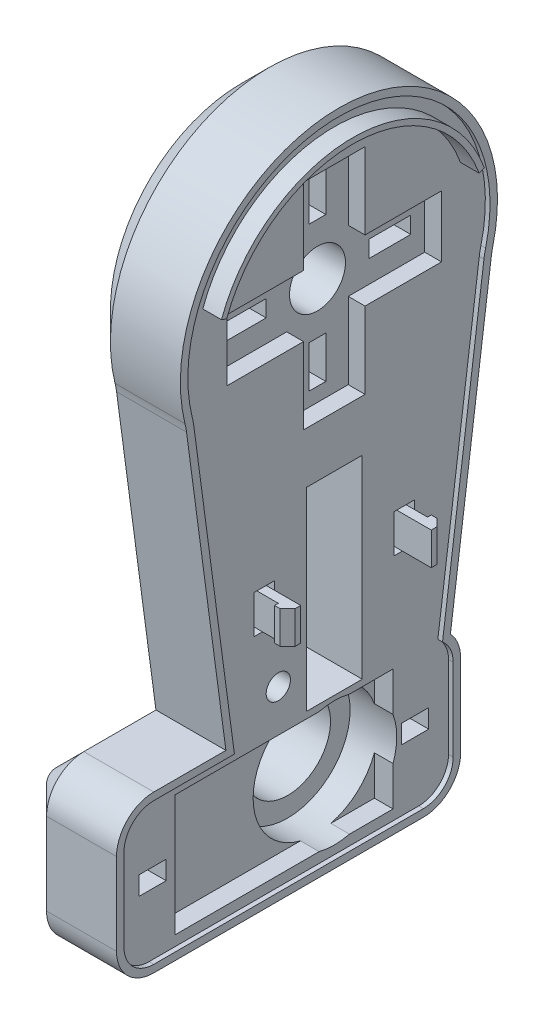
from build123d import *

# Parameters (mm, degrees)
BOSS_EXTRUDE1_START  = -76.4
BOSS_EXTRUDE1_DEPTH  = 10.5
BOSS_EXTRUDE2_START  = -66.4
BOSS_EXTRUDE2_DEPTH  = 0.6
CHAMFER1_SIZE        = 3
CHAMFER2_SIZE        = 3
BOSS_EXTRUDE3_START  = 62.7
SKETCH3_W            = 2.3
SKETCH3_H            = 23
BOSS_EXTRUDE3_DEPTH  = 6.6
BOSS_EXTRUDE4_START  = 54.5
SKETCH4_W            = 2.3
SKETCH4_H            = 6.6
BOSS_EXTRUDE4_DEPTH  = 23
BOSS_EXTRUDE5_START  = -68.2
SKETCH5_R            = 4.6
BOSS_EXTRUDE5_DEPTH  = 2.3
BOSS_EXTRUDE6_START  = -76.9
SKETCH6_R            = 6.1
BOSS_EXTRUDE6_DEPTH  = 1.7
BOSS_EXTRUDE7_START  = -75.3
SKETCH7_R            = 3
BOSS_EXTRUDE7_DEPTH  = 7.2
BOSS_EXTRUDE8_START  = 65.1
SKETCH8_W            = 6.1
SKETCH8_H            = 1.1
BOSS_EXTRUDE8_DEPTH  = 1.8
BOSS_EXTRUDE9_START  = 71.5
SKETCH9_W            = 6.1
SKETCH9_H            = 1.8
BOSS_EXTRUDE9_DEPTH  = 1.1
BOSS_EXTRUDE10_START = 65.1
SKETCH10_W           = 6.1
SKETCH10_H           = 1.1
BOSS_EXTRUDE10_DEPTH = 1.8
BOSS_EXTRUDE11_START = 59.4
SKETCH11_W           = 6.1
SKETCH11_H           = 1.8
BOSS_EXTRUDE11_DEPTH = 1.1
BOSS_EXTRUDE12_START = 65.1
SKETCH12_W           = 7.3
SKETCH12_H           = 3.4
BOSS_EXTRUDE12_DEPTH = 1.8
BOSS_EXTRUDE13_START = 72.6
SKETCH13_W           = 7.3
SKETCH13_H           = 1.8
BOSS_EXTRUDE13_DEPTH = 3.4
BOSS_EXTRUDE14_START = 65.1
SKETCH14_W           = 7.3
SKETCH14_H           = 3.4
BOSS_EXTRUDE14_DEPTH = 1.8
BOSS_EXTRUDE15_START = 56
SKETCH15_W           = 7.3
SKETCH15_H           = 1.8
BOSS_EXTRUDE15_DEPTH = 3.4
BOSS_EXTRUDE16_START = -66.45
BOSS_EXTRUDE16_DEPTH = 2.05
BOSS_EXTRUDE17_START = 55.875
SKETCH17_W           = 4.1
SKETCH17_H           = 2
BOSS_EXTRUDE17_DEPTH = 2.9
BOSS_EXTRUDE18_START = 84.025
SKETCH18_W           = 4.1
SKETCH18_H           = 2
BOSS_EXTRUDE18_DEPTH = 2.9
BOSS_EXTRUDE19_START = 59.7
SKETCH19_W           = 2.1
SKETCH19_H           = 13
BOSS_EXTRUDE19_DEPTH = 23.4
BOSS_EXTRUDE20_START = -71.4
SKETCH20_R           = 6.7
BOSS_EXTRUDE20_DEPTH = 5.1
BOSS_EXTRUDE21_START = -76.9
SKETCH21_R           = 4.6
BOSS_EXTRUDE21_DEPTH = 5.8
BOSS_EXTRUDE22_START = 63
SKETCH22_W           = 8.3
SKETCH22_H           = 20.8
BOSS_EXTRUDE22_DEPTH = 6
BOSS_EXTRUDE23_START = -76.9
SKETCH23_R           = 2.3
BOSS_EXTRUDE23_DEPTH = 6
BOSS_EXTRUDE24_START = -70.95
SKETCH24_R           = 1.3
BOSS_EXTRUDE24_DEPTH = 4.65
BOSS_EXTRUDE25_START = 57.4
SKETCH25_W           = 4.1
SKETCH25_H           = 4.1
BOSS_EXTRUDE25_DEPTH = 2.2
BOSS_EXTRUDE26_START = -47.75
BOSS_EXTRUDE26_DEPTH = 3.5
BOSS_EXTRUDE27_START = 72.4
SKETCH27_W           = 4.1
SKETCH27_H           = 4.1
BOSS_EXTRUDE27_DEPTH = 2.2
BOSS_EXTRUDE28_START = -47.75
BOSS_EXTRUDE28_DEPTH = 3.5


with BuildPart() as part:
    # Sketch1 → Boss-Extrude1 (new body)
    with BuildSketch(Plane(origin=(0, 0, 0), x_dir=(0, 0, -1), z_dir=(1, 0, 0)).offset(BOSS_EXTRUDE1_START)):
        with BuildLine():
            Line((-49.657293521, -24.929701405), (-54.04649339, -57.848700423))
            ThreePointArc((-54.04649339, -57.848700423), (-53.234221048, -59.119126346), (-52.95, -60.6))
            Line((-52.95, -60.6), (-52.95, -69.4))
            ThreePointArc((-52.95, -69.4), (-54.121572875, -72.228427125), (-56.95, -73.4))
            Line((-56.95, -73.4), (-85.85, -73.4))
            ThreePointArc((-85.85, -73.4), (-88.678427125, -72.228427125), (-89.85, -69.4))
            Line((-89.85, -69.4), (-89.85, -60.6))
            ThreePointArc((-89.85, -60.6), (-88.678427125, -57.771572875), (-85.85, -56.6))
            Line((-85.85, -56.6), (-78.12, -56.6))
            Line((-78.12, -56.6), (-82.342706479, -24.929701405))
            ThreePointArc((-82.342706479, -24.929701405), (-82.412282932, -24.49821266), (-82.505320186, -24.071167593))
            ThreePointArc((-82.505320186, -24.071167593), (-66, -3), (-49.494679814, -24.071167593))
            ThreePointArc((-49.494679814, -24.071167593), (-49.587717068, -24.49821266), (-49.657293521, -24.929701405))
        make_face()
    extrude(amount=BOSS_EXTRUDE1_DEPTH)


with BuildPart() as body_2:
    # Sketch2 → Boss-Extrude2 (new body)
    with BuildSketch(Plane(origin=(0, 0, 0), x_dir=(0, 0, -1), z_dir=(1, 0, 0)).offset(BOSS_EXTRUDE2_START)):
        with BuildLine():
            Line((-50.450275841, -24.823970429), (-54.893518409, -58.148289686))
            ThreePointArc((-54.893518409, -58.148289686), (-54.049936113, -59.247362039), (-53.75, -60.6))
            Line((-53.75, -60.6), (-53.75, -69.4))
            ThreePointArc((-53.75, -69.4), (-54.6872583, -71.6627417), (-56.95, -72.6))
            Line((-56.95, -72.6), (-85.85, -72.6))
            ThreePointArc((-85.85, -72.6), (-88.1127417, -71.6627417), (-89.05, -69.4))
            Line((-89.05, -69.4), (-89.05, -60.6))
            ThreePointArc((-89.05, -60.6), (-88.1127417, -58.3372583), (-85.85, -57.4))
            Line((-85.85, -57.4), (-77.206253549, -57.4))
            Line((-77.206253549, -57.4), (-81.549724159, -24.823970429))
            ThreePointArc((-81.549724159, -24.823970429), (-81.626258257, -24.34933281), (-81.728599236, -23.879583236))
            ThreePointArc((-81.728599236, -23.879583236), (-66, -3.8), (-50.271400764, -23.879583236))
            ThreePointArc((-50.271400764, -23.879583236), (-50.373741743, -24.34933281), (-50.450275841, -24.823970429))
        make_face()
    extrude(amount=BOSS_EXTRUDE2_DEPTH)


with BuildPart() as part_1:
    add(part.part)

    # Combine1: cut body 2
    add(body_2.part, mode=Mode.SUBTRACT)

    # Chamfer1
    chamfer1_edges = [part_1.edges().sort_by_distance(p)[0] for p in [
        (-76.4, -3, 66),
        (-76.4, -24.49821266, 49.587717068),
        (-76.4, -41.389200914, 51.851893455),
        (-76.4, -40.764850703, 80.23135324),
        (-76.4, -24.49821266, 82.412282932),
    ]]
    chamfer(chamfer1_edges, length=CHAMFER1_SIZE)

    # Chamfer2
    chamfer2_edges = [part_1.edges().sort_by_distance(p)[0] for p in [
        (-76.4, -57.786965833, 54.106263237),
        (-76.4, -65, 52.95),
        (-76.4, -72.228427125, 54.121572875),
        (-76.4, -73.4, 71.4),
        (-76.4, -72.228427125, 88.678427125),
        (-76.4, -65, 89.85),
        (-76.4, -57.771572875, 88.678427125),
        (-76.4, -56.6, 80.471725405),
    ]]
    chamfer(chamfer2_edges, length=CHAMFER2_SIZE)


with BuildPart() as body_2_2:
    # Sketch3 → Boss-Extrude3 (new body)
    with BuildSketch(Plane.XY.offset(BOSS_EXTRUDE3_START)):
        with Locations((-67.05, -20)):
            Rectangle(SKETCH3_W, SKETCH3_H)
    extrude(amount=BOSS_EXTRUDE3_DEPTH)


with BuildPart() as part_2:
    add(part_1.part)

    # Combine2: cut body 2 2
    add(body_2_2.part, mode=Mode.SUBTRACT)


with BuildPart() as body_2_3:
    # Sketch4 → Boss-Extrude4 (new body)
    with BuildSketch(Plane.XY.offset(BOSS_EXTRUDE4_START)):
        with Locations((-67.05, -20)):
            Rectangle(SKETCH4_W, SKETCH4_H)
    extrude(amount=BOSS_EXTRUDE4_DEPTH)


with BuildPart() as part_3:
    add(part_2.part)

    # Combine3: cut body 2 3
    add(body_2_3.part, mode=Mode.SUBTRACT)


with BuildPart() as body_2_4:
    # Sketch5 → Boss-Extrude5 (new body)
    with BuildSketch(Plane(origin=(0, 0, 0), x_dir=(0, 0, -1), z_dir=(1, 0, 0)).offset(BOSS_EXTRUDE5_START)):
        with Locations((-66, -20)):
            Circle(SKETCH5_R)
    extrude(amount=BOSS_EXTRUDE5_DEPTH)


with BuildPart() as part_4:
    add(part_3.part)

    # Combine4: cut body 2 4
    add(body_2_4.part, mode=Mode.SUBTRACT)


with BuildPart() as body_2_5:
    # Sketch6 → Boss-Extrude6 (new body)
    with BuildSketch(Plane(origin=(0, 0, 0), x_dir=(0, 0, -1), z_dir=(1, 0, 0)).offset(BOSS_EXTRUDE6_START)):
        with Locations((-66, -20)):
            Circle(SKETCH6_R)
    extrude(amount=BOSS_EXTRUDE6_DEPTH)


with BuildPart() as part_5:
    add(part_4.part)

    # Combine5: cut body 2 5
    add(body_2_5.part, mode=Mode.SUBTRACT)


with BuildPart() as body_2_6:
    # Sketch7 → Boss-Extrude7 (new body)
    with BuildSketch(Plane(origin=(0, 0, 0), x_dir=(0, 0, -1), z_dir=(1, 0, 0)).offset(BOSS_EXTRUDE7_START)):
        with Locations((-66, -20)):
            Circle(SKETCH7_R)
    extrude(amount=BOSS_EXTRUDE7_DEPTH)


with BuildPart() as part_6:
    add(part_5.part)

    # Combine6: cut body 2 6
    add(body_2_6.part, mode=Mode.SUBTRACT)


with BuildPart() as body_2_7:
    # Sketch8 → Boss-Extrude8 (new body)
    with BuildSketch(Plane.XY.offset(BOSS_EXTRUDE8_START)):
        with Locations((-71.15, -13.95)):
            Rectangle(SKETCH8_W, SKETCH8_H)
    extrude(amount=BOSS_EXTRUDE8_DEPTH)


with BuildPart() as part_7:
    add(part_6.part)

    # Combine7: cut body 2 7
    add(body_2_7.part, mode=Mode.SUBTRACT)


with BuildPart() as body_2_8:
    # Sketch9 → Boss-Extrude9 (new body)
    with BuildSketch(Plane.XY.offset(BOSS_EXTRUDE9_START)):
        with Locations((-71.15, -20)):
            Rectangle(SKETCH9_W, SKETCH9_H)
    extrude(amount=BOSS_EXTRUDE9_DEPTH)


with BuildPart() as part_8:
    add(part_7.part)

    # Combine8: cut body 2 8
    add(body_2_8.part, mode=Mode.SUBTRACT)


with BuildPart() as body_2_9:
    # Sketch10 → Boss-Extrude10 (new body)
    with BuildSketch(Plane.XY.offset(BOSS_EXTRUDE10_START)):
        with Locations((-71.15, -26.05)):
            Rectangle(SKETCH10_W, SKETCH10_H)
    extrude(amount=BOSS_EXTRUDE10_DEPTH)


with BuildPart() as part_9:
    add(part_8.part)

    # Combine9: cut body 2 9
    add(body_2_9.part, mode=Mode.SUBTRACT)


with BuildPart() as body_2_10:
    # Sketch11 → Boss-Extrude11 (new body)
    with BuildSketch(Plane.XY.offset(BOSS_EXTRUDE11_START)):
        with Locations((-71.15, -20)):
            Rectangle(SKETCH11_W, SKETCH11_H)
    extrude(amount=BOSS_EXTRUDE11_DEPTH)


with BuildPart() as part_10:
    add(part_9.part)

    # Combine10: cut body 2 10
    add(body_2_10.part, mode=Mode.SUBTRACT)


with BuildPart() as body_2_11:
    # Sketch12 → Boss-Extrude12 (new body)
    with BuildSketch(Plane.XY.offset(BOSS_EXTRUDE12_START)):
        with Locations((-71.75, -11.7)):
            Rectangle(SKETCH12_W, SKETCH12_H)
    extrude(amount=BOSS_EXTRUDE12_DEPTH)


with BuildPart() as part_11:
    add(part_10.part)

    # Combine11: cut body 2 11
    add(body_2_11.part, mode=Mode.SUBTRACT)


with BuildPart() as body_2_12:
    # Sketch13 → Boss-Extrude13 (new body)
    with BuildSketch(Plane.XY.offset(BOSS_EXTRUDE13_START)):
        with Locations((-71.75, -20)):
            Rectangle(SKETCH13_W, SKETCH13_H)
    extrude(amount=BOSS_EXTRUDE13_DEPTH)


with BuildPart() as part_12:
    add(part_11.part)

    # Combine12: cut body 2 12
    add(body_2_12.part, mode=Mode.SUBTRACT)


with BuildPart() as body_2_13:
    # Sketch14 → Boss-Extrude14 (new body)
    with BuildSketch(Plane.XY.offset(BOSS_EXTRUDE14_START)):
        with Locations((-71.75, -28.3)):
            Rectangle(SKETCH14_W, SKETCH14_H)
    extrude(amount=BOSS_EXTRUDE14_DEPTH)


with BuildPart() as part_13:
    add(part_12.part)

    # Combine13: cut body 2 13
    add(body_2_13.part, mode=Mode.SUBTRACT)


with BuildPart() as body_2_14:
    # Sketch15 → Boss-Extrude15 (new body)
    with BuildSketch(Plane.XY.offset(BOSS_EXTRUDE15_START)):
        with Locations((-71.75, -20)):
            Rectangle(SKETCH15_W, SKETCH15_H)
    extrude(amount=BOSS_EXTRUDE15_DEPTH)


with BuildPart() as part_14:
    add(part_13.part)

    # Combine14: cut body 2 14
    add(body_2_14.part, mode=Mode.SUBTRACT)

    # Sketch16 → Boss-Extrude16 (add)
    with BuildSketch(Plane(origin=(0, 0, 0), x_dir=(0, 0, -1), z_dir=(1, 0, 0)).offset(BOSS_EXTRUDE16_START)):
        with BuildLine():
            Line((-51.904610688, -14.86969785), (-52.468426261, -15.074909936))
            ThreePointArc((-52.468426261, -15.074909936), (-66, -5.6), (-79.531573739, -15.074909936))
            Line((-79.531573739, -15.074909936), (-80.095389312, -14.86969785))
            ThreePointArc((-80.095389312, -14.86969785), (-66, -5), (-51.904610688, -14.86969785))
        make_face()
    extrude(amount=BOSS_EXTRUDE16_DEPTH)


with BuildPart() as body_2_15:
    # Sketch17 → Boss-Extrude17 (new body)
    with BuildSketch(Plane.XY.offset(BOSS_EXTRUDE17_START)):
        with Locations((-68.35, -65)):
            Rectangle(SKETCH17_W, SKETCH17_H)
    extrude(amount=BOSS_EXTRUDE17_DEPTH)


with BuildPart() as part_15:
    add(part_14.part)

    # Combine15: cut body 2 15
    add(body_2_15.part, mode=Mode.SUBTRACT)


with BuildPart() as body_2_16:
    # Sketch18 → Boss-Extrude18 (new body)
    with BuildSketch(Plane.XY.offset(BOSS_EXTRUDE18_START)):
        with Locations((-68.35, -65)):
            Rectangle(SKETCH18_W, SKETCH18_H)
    extrude(amount=BOSS_EXTRUDE18_DEPTH)


with BuildPart() as part_16:
    add(part_15.part)

    # Combine16: cut body 2 16
    add(body_2_16.part, mode=Mode.SUBTRACT)


with BuildPart() as body_2_17:
    # Sketch19 → Boss-Extrude19 (new body)
    with BuildSketch(Plane.XY.offset(BOSS_EXTRUDE19_START)):
        with Locations((-67.35, -65)):
            Rectangle(SKETCH19_W, SKETCH19_H)
    extrude(amount=BOSS_EXTRUDE19_DEPTH)


with BuildPart() as part_17:
    add(part_16.part)

    # Combine17: cut body 2 17
    add(body_2_17.part, mode=Mode.SUBTRACT)


with BuildPart() as body_2_18:
    # Sketch20 → Boss-Extrude20 (new body)
    with BuildSketch(Plane(origin=(0, 0, 0), x_dir=(0, 0, -1), z_dir=(1, 0, 0)).offset(BOSS_EXTRUDE20_START)):
        with Locations((-66, -65)):
            Circle(SKETCH20_R)
    extrude(amount=BOSS_EXTRUDE20_DEPTH)


with BuildPart() as part_18:
    add(part_17.part)

    # Combine18: cut body 2 18
    add(body_2_18.part, mode=Mode.SUBTRACT)


with BuildPart() as body_2_19:
    # Sketch21 → Boss-Extrude21 (new body)
    with BuildSketch(Plane(origin=(0, 0, 0), x_dir=(0, 0, -1), z_dir=(1, 0, 0)).offset(BOSS_EXTRUDE21_START)):
        with Locations(Location((-66, -65, 0), (0, 0, 180))):
            Circle(SKETCH21_R)
    extrude(amount=BOSS_EXTRUDE21_DEPTH)


with BuildPart() as part_19:
    add(part_18.part)

    # Combine19: cut body 2 19
    add(body_2_19.part, mode=Mode.SUBTRACT)


with BuildPart() as body_2_20:
    # Sketch22 → Boss-Extrude22 (new body)
    with BuildSketch(Plane.XY.offset(BOSS_EXTRUDE22_START)):
        with Locations((-70.45, -47.4)):
            Rectangle(SKETCH22_W, SKETCH22_H)
    extrude(amount=BOSS_EXTRUDE22_DEPTH)


with BuildPart() as part_20:
    add(part_19.part)

    # Combine20: cut body 2 20
    add(body_2_20.part, mode=Mode.SUBTRACT)


with BuildPart() as body_2_21:
    # Sketch23 → Boss-Extrude23 (new body)
    with BuildSketch(Plane(origin=(0, 0, 0), x_dir=(0, 0, -1), z_dir=(1, 0, 0)).offset(BOSS_EXTRUDE23_START)):
        with Locations((-72, -54)):
            Circle(SKETCH23_R)
    extrude(amount=BOSS_EXTRUDE23_DEPTH)


with BuildPart() as part_21:
    add(part_20.part)

    # Combine21: cut body 2 21
    add(body_2_21.part, mode=Mode.SUBTRACT)


with BuildPart() as body_2_22:
    # Sketch24 → Boss-Extrude24 (new body)
    with BuildSketch(Plane(origin=(0, 0, 0), x_dir=(0, 0, -1), z_dir=(1, 0, 0)).offset(BOSS_EXTRUDE24_START)):
        with Locations((-72, -54)):
            Circle(SKETCH24_R)
    extrude(amount=BOSS_EXTRUDE24_DEPTH)


with BuildPart() as part_22:
    add(part_21.part)

    # Combine22: cut body 2 22
    add(body_2_22.part, mode=Mode.SUBTRACT)


with BuildPart() as body_2_23:
    # Sketch25 → Boss-Extrude25 (new body)
    with BuildSketch(Plane.XY.offset(BOSS_EXTRUDE25_START)):
        with Locations((-68.35, -46)):
            Rectangle(SKETCH25_W, SKETCH25_H)
    extrude(amount=BOSS_EXTRUDE25_DEPTH)


with BuildPart() as part_23:
    add(part_22.part)

    # Combine23: cut body 2 23
    add(body_2_23.part, mode=Mode.SUBTRACT)

    # Sketch26 → Boss-Extrude26 (add)
    with BuildSketch(Plane(origin=(0, 0, 0), x_dir=(1, 0, 0), z_dir=(0, 1, 0)).offset(BOSS_EXTRUDE26_START)):
        Polygon((-70.6, -59), (-70.6, -58), (-64.4, -58), (-64.4, -57.6), (-63.8, -57.6), (-63, -58.4), (-63, -59), align=None)
    extrude(amount=BOSS_EXTRUDE26_DEPTH)


with BuildPart() as body_2_24:
    # Sketch27 → Boss-Extrude27 (new body)
    with BuildSketch(Plane.XY.offset(BOSS_EXTRUDE27_START)):
        with Locations((-68.35, -46)):
            Rectangle(SKETCH27_W, SKETCH27_H)
    extrude(amount=BOSS_EXTRUDE27_DEPTH)


with BuildPart() as part_24:
    add(part_23.part)

    # Combine24: cut body 2 24
    add(body_2_24.part, mode=Mode.SUBTRACT)

    # Sketch28 → Boss-Extrude28 (add)
    with BuildSketch(Plane(origin=(0, 0, 0), x_dir=(1, 0, 0), z_dir=(0, 1, 0)).offset(BOSS_EXTRUDE28_START)):
        Polygon((-70.6, -73), (-70.6, -74), (-64.4, -74), (-64.4, -74.4), (-63.8, -74.4), (-63, -73.6), (-63, -73), align=None)
    extrude(amount=BOSS_EXTRUDE28_DEPTH)


solid = part_24.part
